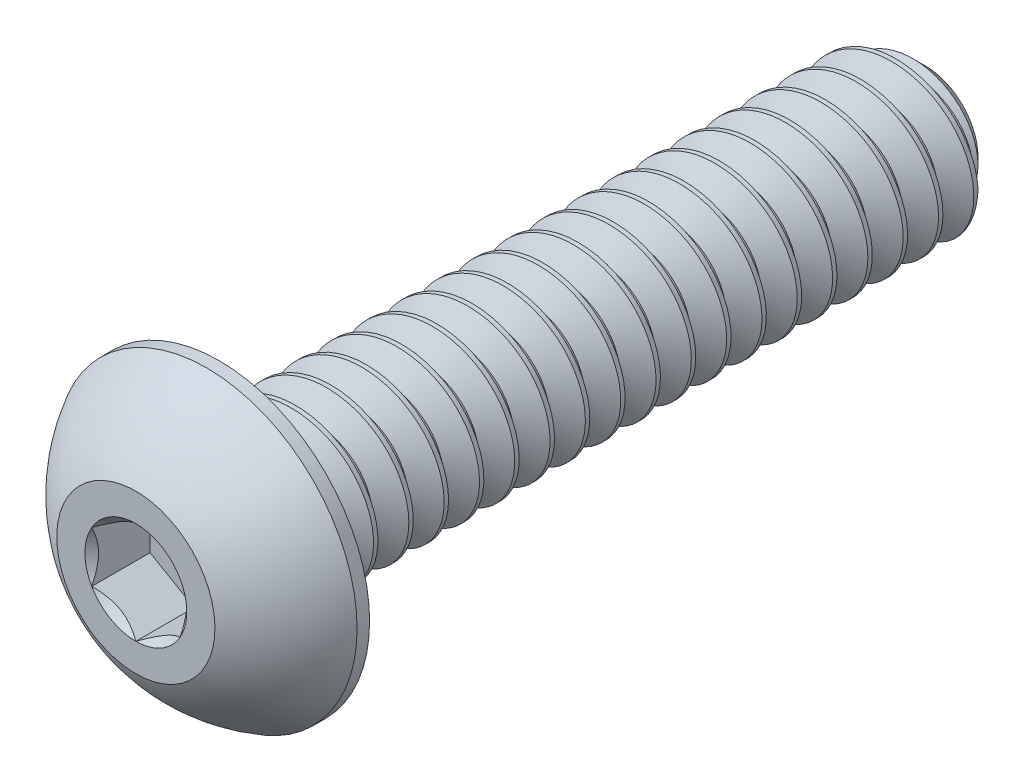
from build123d import *

# Parameters (mm, degrees)
SKETCH1_W          = 12.7
SKETCH1_H          = 1.4224
CHAMFER1_SIZE      = 0.47625
CUT_SWEEP1_PITCH   = 0.635
CUT_EXTRUDE2_DEPTH = 1.04902


with BuildPart() as part:
    # Sketch1 → Revolve1 (revolve)
    with BuildSketch(Plane(origin=(0, 0, 0), x_dir=(0, 0, -1), z_dir=(1, 0, 0))):
        with Locations((7.8486, 0.7112)):
            Rectangle(SKETCH1_W, SKETCH1_H)
    revolve(axis=Axis((0, 0, -14.1986), (0, 0, 1)))

    # Chamfer1
    chamfer1_edges = [part.edges().sort_by_distance(p)[0] for p in [
        (0, -1.4224, -14.1986),
    ]]
    chamfer(chamfer1_edges, length=CHAMFER1_SIZE)

    # Cut-Sweep1: the profile of Sketch2 profile screwed along a right-hand helix of 21 turns, 6 arcs to a turn; built about Z, then put on its axis
    cut_sweep1_z = Axis((0, 0, 0), (0, 0, 1))
    cut_sweep1_corners = [(1.4227, 0, 0.000173205), (1.4227, 0, -0.555798205), (1.009955401, 0, -0.3175), (1.009955401, 0, -0.238125)]
    with BuildLine(mode=Mode.PRIVATE) as cut_sweep1_profile:
        Line(cut_sweep1_corners[0], cut_sweep1_corners[1])
        Line(cut_sweep1_corners[1], cut_sweep1_corners[2])
        Line(cut_sweep1_corners[2], cut_sweep1_corners[3])
        Line(cut_sweep1_corners[3], cut_sweep1_corners[0])
    cut_sweep1_cap = Face(cut_sweep1_profile.wire())
    cut_sweep1_turn_angles = [0, 30, 60, 90, 120, 150, 180, 210, 240, 270, 300, 330, 360]
    cut_sweep1_turn_weights = [1, 0.8660254037844387, 1, 0.8660254037844387, 1, 0.8660254037844387, 1, 0.8660254037844387, 1, 0.8660254037844387, 1, 0.8660254037844387, 1]
    cut_sweep1_turn_rails = [Edge.make_bspline([Vector(p[0], p[1], 0).rotate(cut_sweep1_z, cut_sweep1_turn_angles[k]) / cut_sweep1_turn_weights[k] + Vector(0, 0, p[2] + CUT_SWEEP1_PITCH * cut_sweep1_turn_angles[k] / 360) for k in range(13)], [0, 0, 0, 1, 1, 2, 2, 3, 3, 4, 4, 5, 5, 6, 6, 6], 2, cut_sweep1_turn_weights) for p in cut_sweep1_corners]
    cut_sweep1_turn_sides = [Face.make_surface_from_curves(cut_sweep1_turn_rails[p[0]], cut_sweep1_turn_rails[p[1]]) for p in [(0, 1), (1, 2), (2, 3), (3, 0)]]
    cut_sweep1 = Plane(origin=(0, 0, -14.1986), x_dir=(0, 1, 0), z_dir=(0, 0, 1)) * Solid(Shell([*[p.moved(Location((0, 0, CUT_SWEEP1_PITCH * i))) for i in range(21) for p in cut_sweep1_turn_sides], cut_sweep1_cap, cut_sweep1_cap.rotate(cut_sweep1_z, 7560).moved(Location((0, 0, CUT_SWEEP1_PITCH * 7560 / 360)))]))
    add(cut_sweep1, mode=Mode.SUBTRACT)

    # Sketch7 → Revolve2 (revolve)
    with BuildSketch(Plane(origin=(0, 0, 0), x_dir=(0, 0, -1), z_dir=(1, 0, 0)), mode=Mode.PRIVATE) as revolve2_sk:
        with BuildLine():
            Line((1.27381, 2.7051), (1.4986, 2.7051))
            Line((1.4986, 2.7051), (1.4986, 0))
            Line((1.4986, 0), (0, 0))
            Line((0, 0), (0, 1.4224))
            ThreePointArc((0, 1.4224), (0.540190256, 2.159794444), (1.27381, 2.7051))
        make_face()
    revolve(revolve2_sk.sketch.rotate(Axis((0, 0, 0), (0, 0, -1)), 189.336081704), axis=Axis((0, 0, 0), (0, 0, -1)))

    # Sketch5 → Cut-Extrude2 (cut)
    with BuildSketch(Plane.XY):
        Polygon((0.79375, -0.458271776), (0.79375, 0.458271776), (0, 0.916543552), (-0.79375, 0.458271776), (-0.79375, -0.458271776), (0, -0.916543552), align=None)
    extrude(amount=-CUT_EXTRUDE2_DEPTH, mode=Mode.SUBTRACT)

    # Cut-Extrude3 cone 1 section (through the dimple's axis) → Cut-Extrude3 (revolve, cut)
    with BuildSketch(Plane(origin=(0, 0, 0), x_dir=(0, -1, 0), z_dir=(1, 0, 0))):
        Polygon((0, 0), (0.916543552, 0), (0, 0.916543552), align=None)
    revolve(axis=Axis((0, 0, 0), (0, 0, -1)), mode=Mode.SUBTRACT)


solid = part.part
